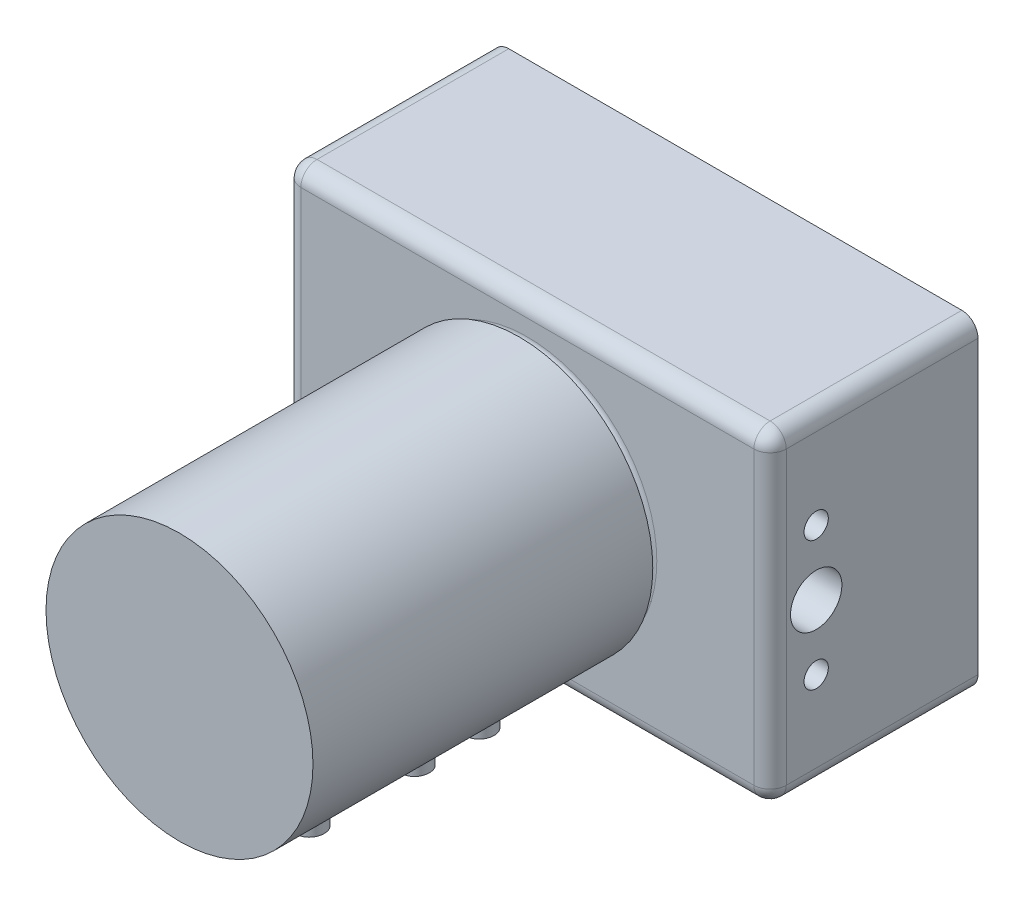
from build123d import *

# Parameters (mm, degrees)
BOSS_EXTRUDE1_DEPTH      = 25.7
SKETCH2_R                = 15
BOSS_EXTRUDE2_DEPTH      = 1
FILLET1_R                = 1
FILLET2_R                = 2
SKETCH3_R                = 16.5
BOSS_EXTRUDE3_DEPTH      = 42
SKETCH4_R                = 3.175
SKETCH4_R_2              = 1.5
CUT_EXTRUDE1_DEPTH       = 5
BOSS_EXTRUDE4_REACH      = 79.587
BOSS_EXTRUDE4_END_RADIUS = 16.5
SKETCH5_R                = 1.7
SKETCH6_R                = 3.175
SKETCH6_R_2              = 1.5
CUT_EXTRUDE2_DEPTH       = 5


with BuildPart() as part:
    # Sketch1 → Boss-Extrude1 (new body)
    with BuildSketch(Plane.XY):
        with BuildLine():
            Line((-28, 20), (28, 20))
            ThreePointArc((28, 20), (29.414213562, 19.414213562), (30, 18))
            Line((30, 18), (30, -18))
            ThreePointArc((30, -18), (29.414213562, -19.414213562), (28, -20))
            Line((28, -20), (-28, -20))
            ThreePointArc((-28, -20), (-29.414213562, -19.414213562), (-30, -18))
            Line((-30, -18), (-30, 18))
            ThreePointArc((-30, 18), (-29.414213562, 19.414213562), (-28, 20))
        make_face()
    extrude(amount=BOSS_EXTRUDE1_DEPTH)

    # Sketch2 → Boss-Extrude2 (add)
    with BuildSketch(Plane.XY.offset(25.7)):
        Circle(SKETCH2_R)
    extrude(amount=BOSS_EXTRUDE2_DEPTH)

    # Fillet1
    fillet1_edges = [part.edges().sort_by_distance(p)[0] for p in [
        (-15, 0, 25.7),
    ]]
    fillet(fillet1_edges, radius=FILLET1_R - 0.0001)  # a hair under: the kernel refuses the full size

    # Fillet2
    fillet2_edges = [part.edges().sort_by_distance(p)[0] for p in [
        (29.414213562, -19.414213562, 25.7),
        (30, 0, 25.7),
        (29.414213562, 19.414213562, 25.7),
        (0, 20, 25.7),
        (-29.414213562, 19.414213562, 25.7),
        (-30, 0, 25.7),
        (-29.414213562, -19.414213562, 25.7),
        (0, -20, 25.7),
    ]]
    fillet(fillet2_edges, radius=FILLET2_R)

    # Sketch3 → Boss-Extrude3 (add)
    with BuildSketch(Plane.XY.offset(26.7)):
        with Locations(Location((0, 0, 0), (0, 0, 180))):
            Circle(SKETCH3_R)
    extrude(amount=BOSS_EXTRUDE3_DEPTH)

    # Sketch4 → Cut-Extrude1 (cut)
    with BuildSketch(Plane.XZ.offset(20)):
        with Locations(Location((0, 20, 0), (0, 0, 270))):
            Circle(SKETCH4_R)
        with Locations(Location((-8, 20, 0), (0, 0, 270))):
            Circle(SKETCH4_R_2)
        with Locations(Location((8, 20, 0), (0, 0, 90))):
            Circle(SKETCH4_R_2)
    extrude(amount=-CUT_EXTRUDE1_DEPTH, mode=Mode.SUBTRACT)

    # Boss-Extrude4: up to this cylinder (the profile starts inside it)
    boss_extrude4_end = Plane(origin=(0, -6.5, 42), z_dir=(0, 0, -1)) * Cylinder(BOSS_EXTRUDE4_END_RADIUS, 214.174, mode=Mode.PRIVATE)
    # Sketch5 → Boss-Extrude4 (add, up to the surface)
    with BuildSketch(Plane(origin=(0, 0, 0), x_dir=(1, 0, 0), z_dir=(0, 1, 0)), mode=Mode.PRIVATE) as boss_extrude4_sk1:
        with Locations(Location((0, -31.5, 0), (0, 0, 270))):
            Circle(SKETCH5_R)
    boss_extrude4_tool1 = extrude(boss_extrude4_sk1.sketch, amount=-BOSS_EXTRUDE4_REACH, mode=Mode.PRIVATE) & boss_extrude4_end
    add(boss_extrude4_tool1.solids().sort_by_distance((0, 0, 31.5))[0])
    # Sketch5 → Boss-Extrude4 (add, up to the surface)
    with BuildSketch(Plane(origin=(0, 0, 0), x_dir=(1, 0, 0), z_dir=(0, 1, 0)), mode=Mode.PRIVATE) as boss_extrude4_sk2:
        with Locations(Location((0, -39.5, 0), (0, 0, 270))):
            Circle(SKETCH5_R)
    boss_extrude4_tool2 = extrude(boss_extrude4_sk2.sketch, amount=-BOSS_EXTRUDE4_REACH, mode=Mode.PRIVATE) & boss_extrude4_end
    add(boss_extrude4_tool2.solids().sort_by_distance((0, 0, 39.5))[0])
    # Sketch5 → Boss-Extrude4 (add, up to the surface)
    with BuildSketch(Plane(origin=(0, 0, 0), x_dir=(1, 0, 0), z_dir=(0, 1, 0)), mode=Mode.PRIVATE) as boss_extrude4_sk3:
        with Locations(Location((0, -52.5, 0), (0, 0, 270))):
            Circle(SKETCH5_R)
    boss_extrude4_tool3 = extrude(boss_extrude4_sk3.sketch, amount=-BOSS_EXTRUDE4_REACH, mode=Mode.PRIVATE) & boss_extrude4_end
    add(boss_extrude4_tool3.solids().sort_by_distance((0, 0, 52.5))[0])

    # Sketch6 → Cut-Extrude2 (cut)
    with BuildSketch(Plane(origin=(30, 0, 0), x_dir=(0, 0, -1), z_dir=(1, 0, 0))):
        with Locations(Location((-20, 0, 0), (0, 0, 90))):
            Circle(SKETCH6_R)
        with Locations(Location((-20, -8, 0), (0, 0, 90))):
            Circle(SKETCH6_R_2)
        with Locations(Location((-20, 8, 0), (0, 0, 270))):
            Circle(SKETCH6_R_2)
    cut_extrude2 = extrude(amount=-CUT_EXTRUDE2_DEPTH, mode=Mode.SUBTRACT)

    # Mirror1: Cut-Extrude2 across plane
    add(cut_extrude2.mirror(Plane(origin=(0, 0, 0), x_dir=(0, 0, 1), z_dir=(1, 0, 0))), mode=Mode.SUBTRACT)


solid = part.part
